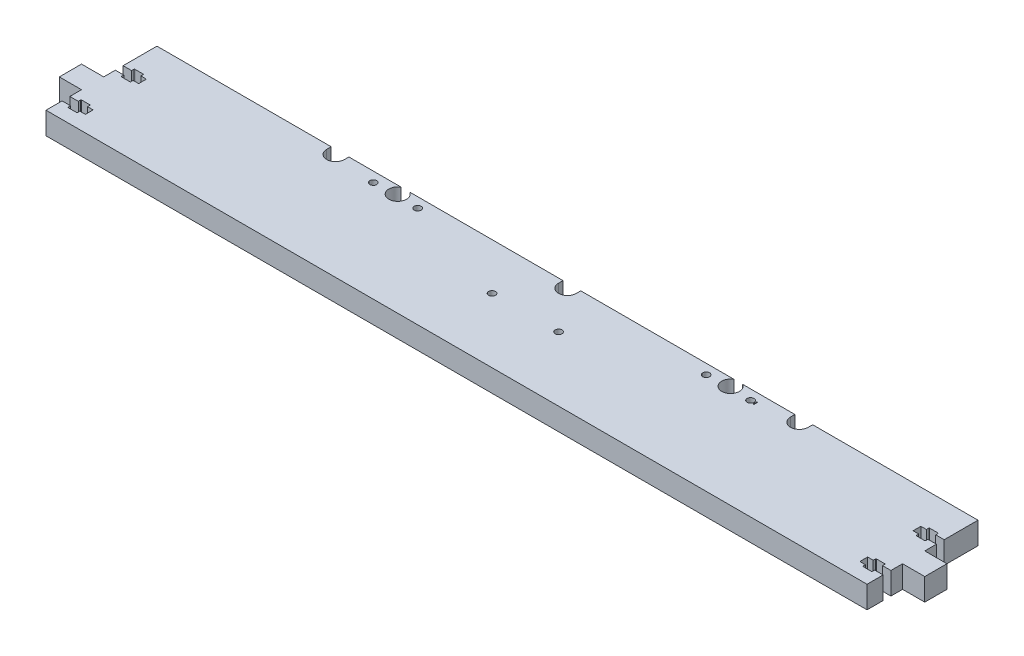
from build123d import *

# Parameters (mm, degrees)
MAINBODY_DEPTH                 = 10
SCREWCUTOUTS_DEPTH             = 197.85019685
SKETCH3_R                      = 4
SKETCH3_R_2                    = 1.55
RODCUTOUTS_DEPTH               = 197.85019685
SKETCH6_R                      = 1.55
CUT_EXTRUDE1_DEPTH             = 197.85019685
BEDADJUSTMENTSCREWCUTOUT_DEPTH = 197.85019685
DIRECTIONKEY_DEPTH             = 197.85019685
CUT_EXTRUDE2_DEPTH             = 197.85019685


with BuildPart() as part:
    # Sketch1 → MainBody (new body)
    with BuildSketch(Plane(origin=(0, 0, 0), x_dir=(1, 0, 0), z_dir=(0, 1, 0))):
        Polygon((0, -25), (0, 25), (-185, 25), (-185, 1), (-195, 1), (-195, -9), (-185, -9), (-185, -25), align=None)
    mainbody = extrude(amount=MAINBODY_DEPTH)

    # Sketch5 → ScrewCutouts (cut, through all)
    with BuildSketch(Plane(origin=(0, 10, 0), x_dir=(1, 0, 0), z_dir=(0, 1, 0))):
        with BuildLine():
            Line((-185, 9.75), (-181.2, 9.75))
            Line((-181.2, 9.75), (-181.2, 10.75))
            ThreePointArc((-181.2, 10.75), (-181.126776695, 10.926776695), (-180.95, 11))
            Line((-180.95, 11), (-177.25, 11))
            ThreePointArc((-177.25, 11), (-177.073223305, 10.926776695), (-177, 10.75))
            Line((-177, 10.75), (-177, 9.75))
            Line((-177, 9.75), (-174.5, 9.75))
            Line((-174.5, 9.75), (-174.5, 6.25))
            Line((-174.5, 6.25), (-177, 6.25))
            Line((-177, 6.25), (-177, 5.25))
            ThreePointArc((-177, 5.25), (-177.073223305, 5.073223305), (-177.25, 5))
            Line((-177.25, 5), (-180.95, 5))
            ThreePointArc((-180.95, 5), (-181.126776695, 5.073223305), (-181.2, 5.25))
            Line((-181.2, 5.25), (-181.2, 6.25))
            Line((-181.2, 6.25), (-185, 6.25))
            Line((-185, 6.25), (-185, 9.75))
        make_face()
        with BuildLine():
            Line((-185, -14.25), (-181.2, -14.25))
            Line((-181.2, -14.25), (-181.2, -13.25))
            ThreePointArc((-181.2, -13.25), (-181.126776695, -13.073223305), (-180.95, -13))
            Line((-180.95, -13), (-177.25, -13))
            ThreePointArc((-177.25, -13), (-177.073223305, -13.073223305), (-177, -13.25))
            Line((-177, -13.25), (-177, -14.25))
            Line((-177, -14.25), (-174.5, -14.25))
            Line((-174.5, -14.25), (-174.5, -17.75))
            Line((-174.5, -17.75), (-177, -17.75))
            Line((-177, -17.75), (-177, -18.75))
            ThreePointArc((-177, -18.75), (-177.073223305, -18.926776695), (-177.25, -19))
            Line((-177.25, -19), (-180.95, -19))
            ThreePointArc((-180.95, -19), (-181.126776695, -18.926776695), (-181.2, -18.75))
            Line((-181.2, -18.75), (-181.2, -17.75))
            Line((-181.2, -17.75), (-185, -17.75))
            Line((-185, -17.75), (-185, -14.25))
        make_face()
    screwcutouts = extrude(amount=-SCREWCUTOUTS_DEPTH, mode=Mode.SUBTRACT)

    # Mirror1: MainBody, ScrewCutouts across plane
    add(mainbody.mirror(Plane(origin=(0, 0, 0), x_dir=(0, 0, 1), z_dir=(1, 0, 0))))
    add(screwcutouts.mirror(Plane(origin=(0, 0, 0), x_dir=(0, 0, 1), z_dir=(1, 0, 0))), mode=Mode.SUBTRACT)

    # Sketch3 → RodCutouts (cut, through all)
    with BuildSketch(Plane(origin=(0, 10, 0), x_dir=(1, 0, 0), z_dir=(0, 1, 0))):
        with Locations((-73, 21.5)):
            Circle(SKETCH3_R)
        with Locations((-83, 20.5)):
            Circle(SKETCH3_R_2)
        with Locations((-63, 20.5)):
            Circle(SKETCH3_R_2)
        with Locations((67, 20.5)):
            Circle(SKETCH3_R_2)
        with Locations((87, 20.5)):
            Circle(SKETCH3_R_2)
        with Locations((77, 21.5)):
            Circle(SKETCH3_R)
    extrude(amount=-RODCUTOUTS_DEPTH, mode=Mode.SUBTRACT)

    # Sketch6 → Cut-Extrude1 (cut, through all)
    with BuildSketch(Plane(origin=(0, 10, 0), x_dir=(1, 0, 0), z_dir=(0, 1, 0))):
        with Locations((-13, 4)):
            Circle(SKETCH6_R)
        with Locations((17, 4)):
            Circle(SKETCH6_R)
    extrude(amount=-CUT_EXTRUDE1_DEPTH, mode=Mode.SUBTRACT)

    # Sketch7 → BedAdjustmentScrewCutout (cut, through all)
    with BuildSketch(Plane(origin=(0, 10, 0), x_dir=(1, 0, 0), z_dir=(0, 1, 0))):
        with BuildLine():
            Line((-98.5, 25), (-98.5, 23))
            ThreePointArc((-98.5, 23), (-102.5, 19), (-106.5, 23))
            Line((-106.5, 23), (-106.5, 25))
            ThreePointArc((-106.5, 25), (-102.5, 29), (-98.5, 25))
        make_face()
        with BuildLine():
            Line((102.5, 25), (102.5, 23))
            ThreePointArc((102.5, 23), (106.5, 19), (110.5, 23))
            Line((110.5, 23), (110.5, 25))
            ThreePointArc((110.5, 25), (106.5, 29), (102.5, 25))
        make_face()
    extrude(amount=-BEDADJUSTMENTSCREWCUTOUT_DEPTH, mode=Mode.SUBTRACT)

    # Sketch8 → DirectionKey (cut, through all)
    with BuildSketch(Plane(origin=(0, 10, 0), x_dir=(1, 0, 0), z_dir=(0, 1, 0))):
        Polygon((88.35, 20.5), (89.35, 21.5), (89.35, 19.5), align=None)
    extrude(amount=-DIRECTIONKEY_DEPTH, mode=Mode.SUBTRACT)

    # Sketch9 → Cut-Extrude2 (cut, through all)
    with BuildSketch(Plane(origin=(0, 10, 0), x_dir=(1, 0, 0), z_dir=(0, 1, 0))):
        with BuildLine():
            Line((6, 27), (6, 23))
            ThreePointArc((6, 23), (2, 19), (-2, 23))
            Line((-2, 23), (-2, 27))
            ThreePointArc((-2, 27), (2, 31), (6, 27))
        make_face()
    extrude(amount=-CUT_EXTRUDE2_DEPTH, mode=Mode.SUBTRACT)


solid = part.part
